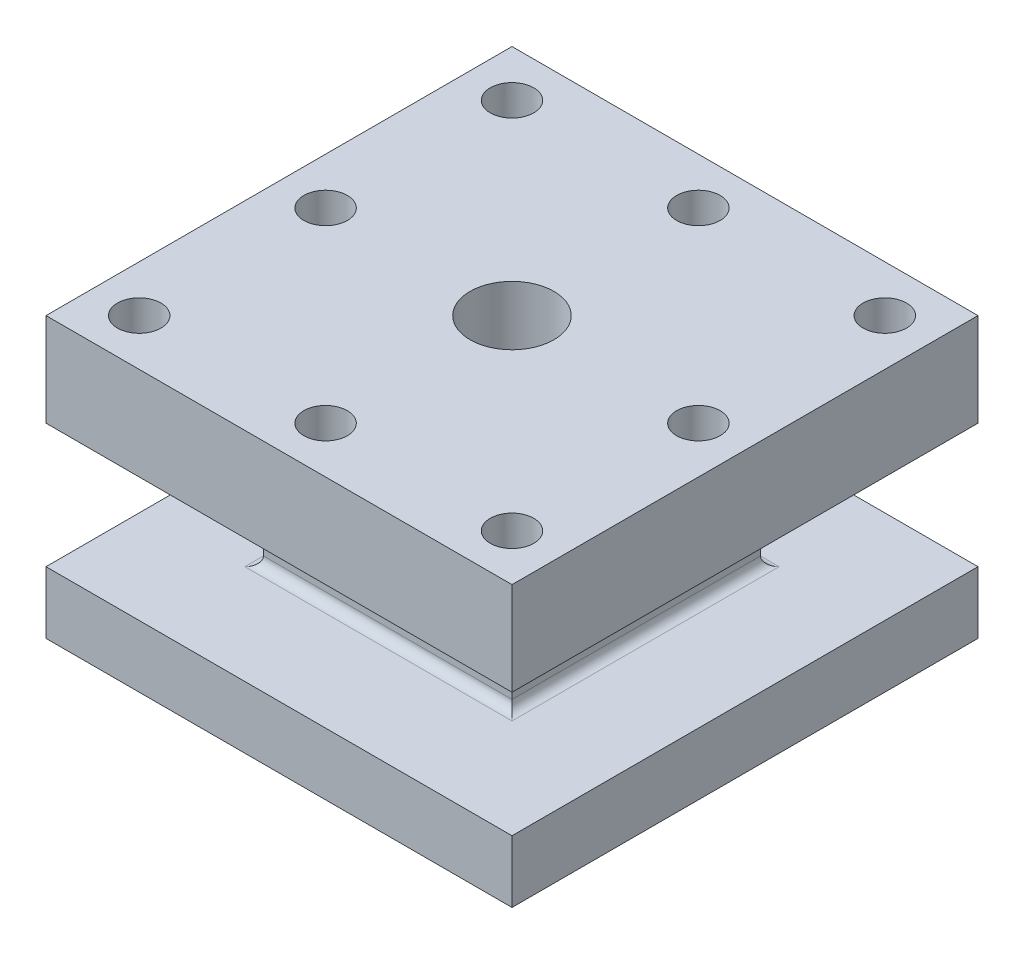
from build123d import *

# Parameters (mm, degrees)
SKETCH1_W                      = 150
SKETCH1_H                      = 150
BOSS_EXTRUDE1_DEPTH            = 20
SKETCH2_W                      = 80
SKETCH2_H                      = 80
BOSS_EXTRUDE2_DEPTH            = 40
SKETCH3_W                      = 150
SKETCH3_H                      = 150
BOSS_EXTRUDE3_DEPTH            = 30
HOLE2_D                        = 27
HOLE2_CBORE_D                  = 60
HOLE2_CBORE_DEPTH              = 10
M16_START                      = 60
M16_TAPPED_HOLE1_OUTLINE_R     = 7
M16_TAPPED_HOLE1_DEPTH         = 30
F_10_0_10_DIAMETER_HOLE1_D     = 10
F_10_0_10_DIAMETER_HOLE1_DEPTH = 14.995696905
F_10_0_10_DIAMETER_HOLE1_TIP   = 3.004303095
FILLET1_R                      = 3
CHAMFER1_SIZE                  = 2


# Read off the part's stored shape, not the designer's step: M16 Tapped Hole1
with BuildPart() as part:
    # Sketch1 → Boss-Extrude1 (new body)
    with BuildSketch(Plane(origin=(0, 0, 0), x_dir=(1, 0, 0), z_dir=(0, 1, 0))):
        Rectangle(SKETCH1_W, SKETCH1_H)
    extrude(amount=BOSS_EXTRUDE1_DEPTH)

    # Sketch2 → Boss-Extrude2 (add)
    with BuildSketch(Plane(origin=(0, 20, 0), x_dir=(1, 0, 0), z_dir=(0, 1, 0))):
        Rectangle(SKETCH2_W, SKETCH2_H)
    extrude(amount=BOSS_EXTRUDE2_DEPTH)

    # Sketch3 → Boss-Extrude3 (add)
    with BuildSketch(Plane(origin=(0, 60, 0), x_dir=(1, 0, 0), z_dir=(0, 1, 0))):
        Rectangle(SKETCH3_W, SKETCH3_H)
    extrude(amount=BOSS_EXTRUDE3_DEPTH)

    # Hole2 (through all)
    with Locations(Plane(origin=(0, 0, 0), x_dir=(0, 0, -1), z_dir=(0, -1, 0))):
        with Locations((0, 0)):
            CounterBoreHole(HOLE2_D / 2, HOLE2_CBORE_D / 2, HOLE2_CBORE_DEPTH)

    # M16 Tapped Hole1 outline → M16 Tapped Hole1 (cut)
    with BuildSketch(Plane(origin=(0, 0, 0), x_dir=(1, 0, 0), z_dir=(0, 1, 0)).offset(M16_START)):
        with Locations((-60, 0)):
            Circle(M16_TAPPED_HOLE1_OUTLINE_R)
        with Locations((0, -60)):
            Circle(M16_TAPPED_HOLE1_OUTLINE_R)
        with Locations((60, 0)):
            Circle(M16_TAPPED_HOLE1_OUTLINE_R)
        with Locations((0, 60)):
            Circle(M16_TAPPED_HOLE1_OUTLINE_R)
        with Locations((60, -60)):
            Circle(M16_TAPPED_HOLE1_OUTLINE_R)
        with Locations((-60, 60)):
            Circle(M16_TAPPED_HOLE1_OUTLINE_R)
        with Locations((-60, -60)):
            Circle(M16_TAPPED_HOLE1_OUTLINE_R)
        with Locations((60, 60)):
            Circle(M16_TAPPED_HOLE1_OUTLINE_R)
    extrude(amount=M16_TAPPED_HOLE1_DEPTH, mode=Mode.SUBTRACT)

    # Ø10.0 (10) Diameter Hole1
    with Locations(Plane(origin=(0, 0, 0), x_dir=(-1, 0, 0), z_dir=(0, -1, 0))):
        with Locations((0, 0), (0, -60), (60, 0), (-60, 0), (0, 60)):
            Hole(F_10_0_10_DIAMETER_HOLE1_D / 2, depth=F_10_0_10_DIAMETER_HOLE1_DEPTH)
            with Locations((0, 0, -(F_10_0_10_DIAMETER_HOLE1_DEPTH + F_10_0_10_DIAMETER_HOLE1_TIP / 2))):  # 118° drill point
                Cone(0, F_10_0_10_DIAMETER_HOLE1_D / 2, F_10_0_10_DIAMETER_HOLE1_TIP, mode=Mode.SUBTRACT)

    # Fillet1
    fillet1_edges = [part.edges().sort_by_distance(p)[0] for p in [
        (40, 20, 0),
        (0, 20, -40),
        (-40, 20, 0),
        (0, 20, 40),
    ]]
    fillet(fillet1_edges, radius=FILLET1_R)

    # Chamfer1
    chamfer1_edges = [part.edges().sort_by_distance(p)[0] for p in [
        (0, 0, 30),
    ]]
    chamfer(chamfer1_edges, length=CHAMFER1_SIZE)


solid = part.part
